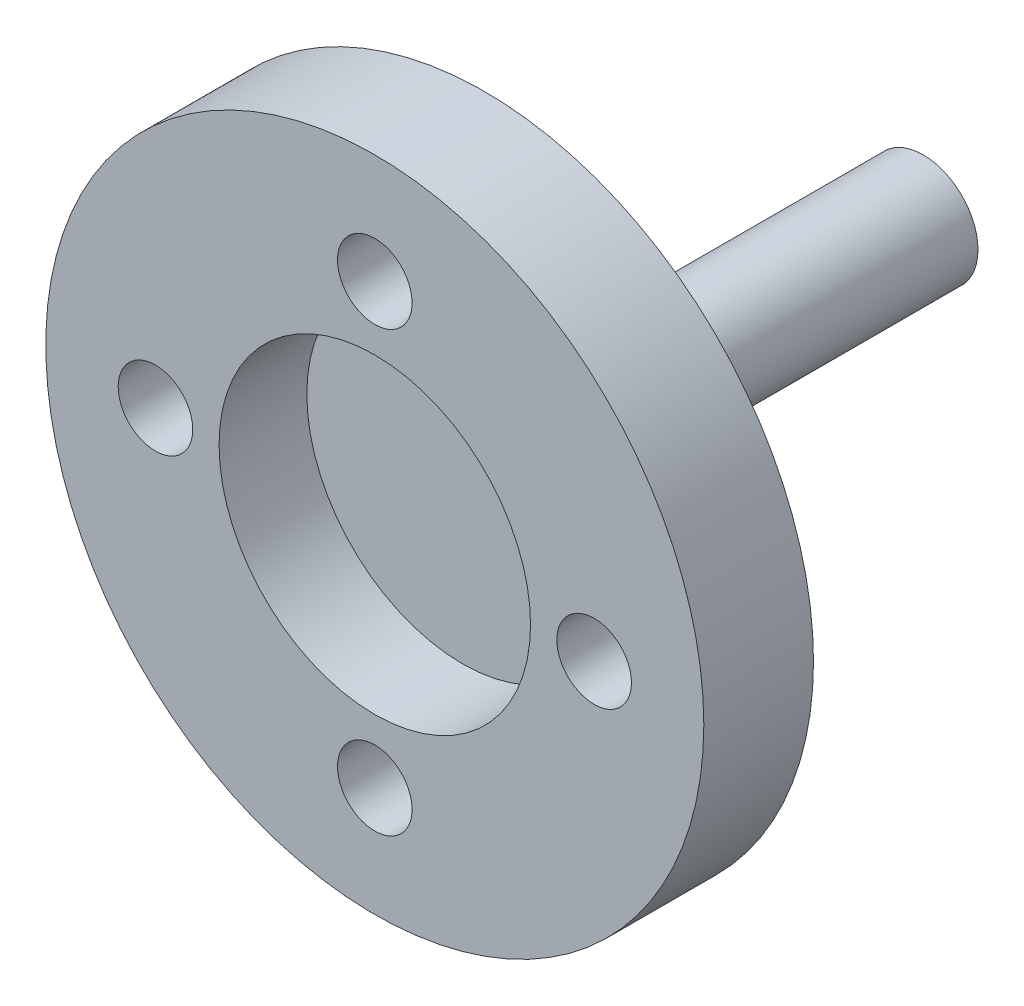
from build123d import *

# Parameters (mm, degrees)
SKETCH_1_R          = 15
EXTRUDE_1_DEPTH     = 5
SKETCH_2_R          = 7.1
CUT_EXTRUDE_1_DEPTH = 4
SKETCH_3_R          = 2.5
EXTRUDE_2_DEPTH     = 20
HOLE_WIZARD_M31_D   = 3.4


with BuildPart() as part:
    # Эскиз1 → Бобышка-Вытянуть1 (new body)
    with BuildSketch(Plane.XY):
        Circle(SKETCH_1_R)
    extrude(amount=EXTRUDE_1_DEPTH)

    # Эскиз2 → Вырез-Вытянуть1 (cut)
    with BuildSketch(Plane.XY.offset(5)):
        Circle(SKETCH_2_R)
    extrude(amount=-CUT_EXTRUDE_1_DEPTH, mode=Mode.SUBTRACT)

    # Эскиз3 → Бобышка-Вытянуть2 (add)
    with BuildSketch(Plane(origin=(0, 0, 0), x_dir=(-1, 0, 0), z_dir=(0, 0, -1))):
        Circle(SKETCH_3_R)
    extrude(amount=EXTRUDE_2_DEPTH)

    # Отверстие с зазором M31 (through all)
    with Locations(Plane(origin=(0, 0, 0), x_dir=(-1, 0, 0), z_dir=(0, 0, -1))):
        with Locations((0, 10), (-10, 0), (0, -10), (10, 0)):
            Hole(HOLE_WIZARD_M31_D / 2)


solid = part.part
